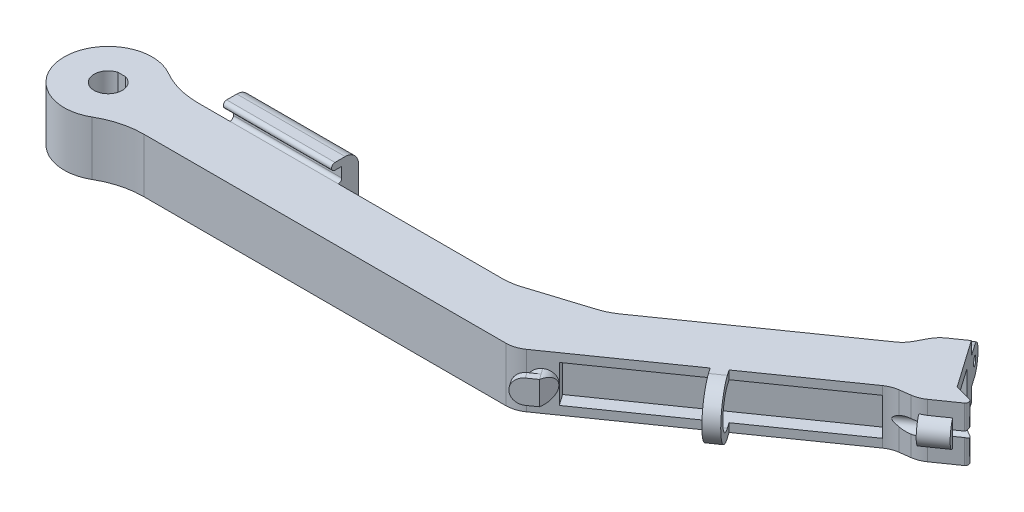
from build123d import *

# Parameters (mm, degrees)
BOSS_EXTRUDE1_DEPTH       = 12.7
SKETCH4_R                 = 10.31875
BOSS_EXTRUDE2_DEPTH       = 12.7
CUT_EXTRUDE1_DEPTH        = 64.271385342
BOSS_EXTRUDE3_DEPTH       = 12.7
BOSS_EXTRUDE4_DEPTH       = 12.7
CUT_EXTRUDE3_START        = -2.794
CUT_EXTRUDE3_DEPTH        = 6.858
BOSS_EXTRUDE5_DEPTH       = 5.715
BOSS_EXTRUDE10_START      = -12.7
BOSS_EXTRUDE10_DEPTH      = 12.7
SKETCH14_W                = 1.0287
SKETCH14_H                = 10.856543086
F_1_CLEARANCE_HOLE3_D     = 2.0574
SKETCH15_R                = 1.5875
CUT_EXTRUDE4_DEPTH        = 7.3025
FILLET1_R                 = 6.35
SKETCH19_W                = 0.8
SKETCH19_H                = 45.577066542
BOSS_EXTRUDE6_DEPTH       = 3.175
F_1_CLEARANCE_HOLE2_D     = 2.0574
F_1_CLEARANCE_HOLE2_DEPTH = 3.175
BOSS_EXTRUDE8_START       = -3.571875
BOSS_EXTRUDE8_DEPTH       = 5.55625
FILLET4_R                 = 2.778125
SKETCH27_W                = 54.393396404
SKETCH27_H                = 8.73125
CUT_EXTRUDE7_DEPTH        = 3.175
FILLET5_RADIUS            = 2.778125
FILLET5_LENGTH            = 1.5875
CUT_EXTRUDE8_DEPTH        = 129.352845118
BOSS_EXTRUDE9_START       = -38.1
BOSS_EXTRUDE9_DEPTH       = 3.175
FILLET6_R                 = 0.79375
BOSS_EXTRUDE11_DEPTH      = 12.7
FILLET7_R                 = 12.7
BOSS_EXTRUDE12_DEPTH      = 4.7625
BOSS_EXTRUDE12_DEPTH_BACK = 17.4625
SKETCH36_W                = 25.4
SKETCH36_H                = 6.35
SKETCH37_W                = 2.38125
SKETCH37_H                = 3.175
CUT_EXTRUDE9_DEPTH        = 25.4
FILLET8_R                 = 3.175
FILLET9_R                 = 0.79375
FILLET10_RADIUS           = 0.79375
FILLET10_LENGTH           = 25.4
FILLET11_RADIUS           = 0.79375
FILLET11_LENGTH           = 25.4
FILLET12_R                = 19.05


# Some blends are built 0.0001 mm under size
with BuildPart() as part:
    # Sketch1 → Boss-Extrude1 (new body)
    with BuildSketch(Plane(origin=(0, 0, 0), x_dir=(1, 0, 0), z_dir=(0, 1, 0))):
        with BuildLine():
            Line((-50.8, 6.35), (50.8, 6.35))
            Line((50.8, 6.35), (50.8, -6.35))
            Line((50.8, -6.35), (-50.8, -6.35))
            ThreePointArc((-50.8, -6.35), (-57.15, 0), (-50.8, 6.35))
        make_face()
    extrude(amount=BOSS_EXTRUDE1_DEPTH)

    # Sketch4 → Boss-Extrude2 (add)
    with BuildSketch(Plane.XZ):
        with Locations((-50.8, 0)):
            Circle(SKETCH4_R)
    extrude(amount=-BOSS_EXTRUDE2_DEPTH)

    # Sketch5 → Cut-Extrude1 (cut, through all)
    with BuildSketch(Plane(origin=(0, 12.7, 0), x_dir=(-1, 0, 0), z_dir=(0, 1, 0))):
        with BuildLine():
            Line((51.689, -3.180075942), (49.911, -3.180075942))
            ThreePointArc((49.911, -3.180075942), (50.8, 3.302), (51.689, -3.180075942))
        make_face()
    extrude(amount=-CUT_EXTRUDE1_DEPTH, mode=Mode.SUBTRACT)

    # Sketch6 → Boss-Extrude3 (add)
    with BuildSketch(Plane(origin=(0, 12.7, 0), x_dir=(1, 0, 0), z_dir=(0, 1, 0))):
        Polygon((95.531734071, 40.475334671), (102.816154812, 30.072103708), (50.8, -6.35), (46.795705381, 6.35), align=None)
    extrude(amount=-BOSS_EXTRUDE3_DEPTH)

    # Sketch9 → Boss-Extrude4 (add)
    with BuildSketch(Plane(origin=(0, 12.7, 0), x_dir=(1, 0, 0), z_dir=(0, 1, 0))):
        Polygon((102.848212808, 48.757142484), (98.135919581, 45.457559244), (95.531734071, 40.475334671), (102.816154812, 30.072103708), (108.38859838, 30.815216452), (113.100891608, 34.114799693), (110.735347669, 37.493146554), (105.213756747, 45.378795623), align=None)
    extrude(amount=-BOSS_EXTRUDE4_DEPTH)

    # Sketch11 → Cut-Extrude3 (cut)
    with BuildSketch(Plane(origin=(0, 12.7, 0), x_dir=(1, 0, 0), z_dir=(0, 1, 0)).offset(CUT_EXTRUDE3_START)):
        Polygon((97.154584621, 40.282155504), (103.189673352, 31.663155561), (108.028410915, 35.051276078), (110.596943675, 37.690807942), (105.352160741, 45.181134235), (101.993322184, 43.670276021), align=None)
    extrude(amount=-CUT_EXTRUDE3_DEPTH, mode=Mode.SUBTRACT)

    # Sketch12 → Boss-Extrude5 (add)
    with BuildSketch(Plane(origin=(91.920550149, 0, -64.36346213), x_dir=(-0.5735764363510415, 0, -0.819152044288995), z_dir=(0.819152044288995, 0, -0.5735764363510415))):
        with BuildLine():
            Line((-36.133048448, 9.525), (-36.133048448, 3.175))
            ThreePointArc((-36.133048448, 3.175), (-39.308048448, 6.35), (-36.133048448, 9.525))
        make_face()
    extrude(amount=-BOSS_EXTRUDE5_DEPTH)

    # Sketch32 → Boss-Extrude10 (add)
    with BuildSketch(Plane(origin=(0, 12.7, 0), x_dir=(1, 0, 0), z_dir=(0, 1, 0)).offset(BOSS_EXTRUDE10_START)):
        Polygon((113.100891608, 34.114799693), (110.596871978, 37.690910336), (116.10160473, 36.215921641), align=None)
    extrude(amount=BOSS_EXTRUDE10_DEPTH)

    # Sketch14 → #1 Clearance Hole1 (revolve, cut)
    with BuildSketch(Plane(origin=(112.645615312, 6.35, -34.765001628), x_dir=(0.5735764363510415, 0, 0.819152044288995), z_dir=(0, 1, 0))):
        with Locations((0.51435, 5.428271543)):
            Rectangle(SKETCH14_W, SKETCH14_H)
    revolve(axis=Axis((107.443999831, 6.35, -31.122791257), (0.819152044288995, 0, -0.5735764363510414)), mode=Mode.SUBTRACT)

    # #1 Clearance Hole3 (through all)
    with Locations(Plane(origin=(91.920550149, 0, -64.36346213), x_dir=(-0.5735764363510417, 0, -0.8191520442889949), z_dir=(0.819152044288995, 0, -0.5735764363510417))):
        with Locations((-36.133048448, 6.35)):
            Hole(F_1_CLEARANCE_HOLE3_D / 2)

    # Sketch15 → Cut-Extrude4 (cut)
    with BuildSketch(Plane(origin=(87.239096215, 0, -61.085472797), x_dir=(0.5735764363510416, 0, 0.819152044288995), z_dir=(-0.8191520442889949, 0, 0.5735764363510415))):
        with Locations((36.133048448, 6.35)):
            Circle(SKETCH15_R)
    extrude(amount=CUT_EXTRUDE4_DEPTH, mode=Mode.SUBTRACT)

    # Fillet1
    # the kernel refuses this fillet: 6.35 mm, written as the material it adds along each edge
    with BuildSketch(Plane(origin=(102.816154812, 12.7, -30.072103708), x_dir=(0.9912250978402455, 0, -0.13218473970771358), z_dir=(0, -1, 0))) as fillet1_piece_1_section:
        with BuildLine():
            CenterArc((FILLET1_R * 0.243812013736, FILLET1_R), FILLET1_R, 242.595858364, 27.404141636)
            Line((-FILLET1_R * 0.21645194575, FILLET1_R * 0.112217882812), (0, 0))
            Line((0, 0), (FILLET1_R * 0.243812013736, 0))
        make_face()
    fillet1_piece_1 = extrude(amount=12.7, mode=Mode.PRIVATE)
    fillet1_piece_1 = fillet1_piece_1 - Plane(origin=(103.804018462, 6.35, -28.574048864), x_dir=(0.5735764363510416, 0, 0.819152044288995), z_dir=(0.819152044288995, 0, -0.5735764363510416)) * Cylinder(1.5875, 32, mode=Mode.PRIVATE)
    add(fillet1_piece_1)
    with BuildSketch(Plane(origin=(95.531734071, 12.7, -40.475334671), x_dir=(-0.8191520442889939, 0, 0.573576436351043), z_dir=(0, -1, 0))) as fillet1_piece_2:
        with BuildLine():
            CenterArc((FILLET1_R * 0.243812013736, FILLET1_R), FILLET1_R, 242.595858364, 27.404141636)
            Line((-FILLET1_R * 0.21645194575, FILLET1_R * 0.112217882812), (0, 0))
            Line((0, 0), (FILLET1_R * 0.243812013736, 0))
        make_face()
    extrude(amount=12.7)
    # the kernel refuses this fillet: 6.35 mm, written as the material it takes off along each edge
    with BuildSketch(Plane(origin=(108.38859838, 16.570515718, -30.815216452), x_dir=(-0.9912250978402455, 0, 0.13218473970771358), z_dir=(0, -1, 0))) as fillet1_2_piece_1_section:
        with BuildLine():
            CenterArc((FILLET1_R * 0.243812013736, FILLET1_R), FILLET1_R, 242.595858364, 27.404141636)
            Line((-FILLET1_R * 0.21645194575, FILLET1_R * 0.112217882812), (0, 0))
            Line((0, 0), (FILLET1_R * 0.243812013736, 0))
        make_face()
    fillet1_2_piece_1 = extrude(amount=12.716216108, mode=Mode.PRIVATE)
    fillet1_2_piece_1 = split(fillet1_2_piece_1, bisect_by=Plane(origin=(108.289049295, 11.085798471, -31.023024265), z_dir=(-0.819152044288995, 0, 0.5735764363510415)), keep=Keep.TOP, mode=Mode.PRIVATE)
    add(fillet1_2_piece_1, mode=Mode.SUBTRACT)
    with BuildSketch(Plane(origin=(108.38859838, 16.570515718, -30.815216452), x_dir=(-0.9912250978402455, 0, 0.13218473970771358), z_dir=(0, -1, 0))) as fillet1_2_piece_2_section:
        with BuildLine():
            CenterArc((FILLET1_R * 0.243812013736, FILLET1_R), FILLET1_R, 242.595858364, 27.404141636)
            Line((-FILLET1_R * 0.21645194575, FILLET1_R * 0.112217882812), (0, 0))
            Line((0, 0), (FILLET1_R * 0.243812013736, 0))
        make_face()
    fillet1_2_piece_2 = extrude(amount=12.716216108, mode=Mode.PRIVATE)
    fillet1_2_piece_2 = fillet1_2_piece_2 - Plane(origin=(108.273018004, 6.35, -31.703276031), x_dir=(0, -1, 0), z_dir=(0.819152044288995, 0, -0.5735764363510415)) * Cylinder(3.175, 32, mode=Mode.PRIVATE)
    add(fillet1_2_piece_2, mode=Mode.SUBTRACT)
    with BuildSketch(Plane(origin=(108.38859838, 8.84570039, -30.815216452), x_dir=(-0.9912250978402455, 0, 0.13218473970771358), z_dir=(0, -1, 0))) as fillet1_2_piece_3_section:
        with BuildLine():
            CenterArc((FILLET1_R * 0.243812013736, FILLET1_R), FILLET1_R, 242.595858364, 27.404141636)
            Line((-FILLET1_R * 0.21645194575, FILLET1_R * 0.112217882812), (0, 0))
            Line((0, 0), (FILLET1_R * 0.243812013736, 0))
        make_face()
    fillet1_2_piece_3 = extrude(amount=12.716216108, mode=Mode.PRIVATE)
    fillet1_2_piece_3 = split(fillet1_2_piece_3, bisect_by=Plane(origin=(108.291596218, 8.335689019, -31.019386881), z_dir=(-0.819152044288995, 0, 0.5735764363510415)), keep=Keep.TOP, mode=Mode.PRIVATE)
    add(fillet1_2_piece_3, mode=Mode.SUBTRACT)
    with BuildSketch(Plane(origin=(108.38859838, 8.84570039, -30.815216452), x_dir=(-0.9912250978402455, 0, 0.13218473970771358), z_dir=(0, -1, 0))) as fillet1_2_piece_4_section:
        with BuildLine():
            CenterArc((FILLET1_R * 0.243812013736, FILLET1_R), FILLET1_R, 242.595858364, 27.404141636)
            Line((-FILLET1_R * 0.21645194575, FILLET1_R * 0.112217882812), (0, 0))
            Line((0, 0), (FILLET1_R * 0.243812013736, 0))
        make_face()
    fillet1_2_piece_4 = extrude(amount=12.716216108, mode=Mode.PRIVATE)
    fillet1_2_piece_4 = fillet1_2_piece_4 - Plane(origin=(108.273018003, 6.35, -31.703276031), x_dir=(0, -1, 0), z_dir=(0.819152044288995, 0, -0.5735764363510415)) * Cylinder(3.175, 32, mode=Mode.PRIVATE)
    add(fillet1_2_piece_4, mode=Mode.SUBTRACT)
    with BuildSketch(Plane(origin=(98.135919581, 16.570515718, -45.457559244), x_dir=(0.8191520442889939, 0, -0.573576436351043), z_dir=(0, -1, 0))) as fillet1_2_piece_5:
        with BuildLine():
            CenterArc((FILLET1_R * 0.243812013736, FILLET1_R), FILLET1_R, 242.595858364, 27.404141636)
            Line((-FILLET1_R * 0.21645194575, FILLET1_R * 0.112217882812), (0, 0))
            Line((0, 0), (FILLET1_R * 0.243812013736, 0))
        make_face()
    extrude(amount=20.441031436, mode=Mode.SUBTRACT)
    with BuildSketch(Plane(origin=(50.8, -5.005368273, 6.35), x_dir=(0.8191520442889954, 0, -0.5735764363510407), z_dir=(0, 1, 0))) as fillet1_2_piece_6:
        with BuildLine():
            CenterArc((FILLET1_R * 0.315298788879, FILLET1_R), FILLET1_R, 235, 35)
            Line((-FILLET1_R * 0.258277647472, FILLET1_R * 0.180847955711), (0, 0))
            Line((0, 0), (FILLET1_R * 0.315298788879, 0))
        make_face()
    extrude(amount=22.710736547, mode=Mode.SUBTRACT)

    # Sketch19 → M2x0.4 Tapped Hole2 (revolve, cut)
    with BuildSketch(Plane(origin=(-50.8, 6.35, -3.180075942), x_dir=(0, -1, 0), z_dir=(1, 0, 0))):
        with Locations((0.4, 22.788533271)):
            Rectangle(SKETCH19_W, SKETCH19_H)
    revolve(axis=Axis((-50.8, 6.35, 3.169924058), (0, 0, -1)), mode=Mode.SUBTRACT)

    # Sketch20 → Boss-Extrude6 (add)
    with BuildSketch(Plane(origin=(91.920550149, 0, -64.36346213), x_dir=(-0.5735764363510416, 0, -0.819152044288995), z_dir=(0.8191520442889949, 0, -0.5735764363510415))):
        with BuildLine():
            Line((-19.051798448, 9.525), (-15.876798448, 9.525))
            ThreePointArc((-15.876798448, 9.525), (-12.701798448, 6.35), (-15.876798448, 3.175))
            Line((-15.876798448, 3.175), (-19.051798448, 3.175))
            Line((-19.051798448, 3.175), (-19.051798448, 9.525))
        make_face()
    extrude(amount=-BOSS_EXTRUDE6_DEPTH)

    # #1 Clearance Hole2
    with Locations(Plane(origin=(91.920550149, 0, -64.36346213), x_dir=(-0.5735764363510416, 0, -0.819152044288995), z_dir=(0.8191520442889949, 0, -0.5735764363510415))):
        with Locations((-15.876798448, 6.35)):
            Hole(F_1_CLEARANCE_HOLE2_D / 2, depth=F_1_CLEARANCE_HOLE2_DEPTH)

    # Sketch26 → Boss-Extrude8 (add)
    with BuildSketch(Plane(origin=(0, 12.7, 0), x_dir=(1, 0, 0), z_dir=(0, 1, 0)).offset(BOSS_EXTRUDE8_START)):
        Polygon((52.440063061, -5.201615481), (53.350615654, -6.502019352), (51.400009849, -7.867848241), (52.310562441, -9.168252111), (58.812581793, -4.615489147), (56.991476608, -2.014681407), align=None)
    extrude(amount=-BOSS_EXTRUDE8_DEPTH)

    # Fillet4
    fillet4_edges = [part.edges().sort_by_distance(p)[0] for p in [
        (57.9020292, 3.571875, 3.315085277),
        (52.895339358, 3.571875, 5.851817416),
        (57.9020292, 9.128125, 3.315085277),
        (52.895339358, 9.128125, 5.851817416),
    ]]
    fillet(fillet4_edges, radius=FILLET4_R - 0.0001)  # a hair under: the kernel refuses the full size

    # Sketch27 → Cut-Extrude7 (cut)
    with BuildSketch(Plane(origin=(19.696212431, 0, 28.129106523), x_dir=(0.8191520442889949, 0, -0.5735764363510418), z_dir=(0.5735764363510418, 0, 0.8191520442889949))):
        with Locations((72.72580899, 6.35)):
            Rectangle(SKETCH27_W, SKETCH27_H)
    extrude(amount=-CUT_EXTRUDE7_DEPTH, mode=Mode.SUBTRACT)

    # Fillet5: full round fillet: the end face becomes a half cylinder, R = half its width
    fillet5_face = Plane((51.855286145, 6.35, 8.518050176), x_dir=(0.573576436351, 0, 0.819152044289), z_dir=(-0.819152044289, 0, 0.573576436351))  # on the end face: x along it, z out of the body
    fillet5_slab = fillet5_face.offset(-FILLET5_RADIUS / 2) * Box(FILLET5_LENGTH, 2 * FILLET5_RADIUS, FILLET5_RADIUS, mode=Mode.PRIVATE)  # the body's end, R deep
    fillet5_round = Plane((54.130992918, 6.35, 6.924583139), x_dir=(-0.819152044289, 0, 0.573576436351), z_dir=(0.573576436351, 0, 0.819152044289)) * Cylinder(FILLET5_RADIUS, FILLET5_LENGTH, mode=Mode.PRIVATE)  # its axis R under the face
    add(fillet5_slab - fillet5_round, mode=Mode.SUBTRACT)

    # Sketch28 → Cut-Extrude8 (cut, through all)
    with BuildSketch(Plane(origin=(0, 9.128125, 0), x_dir=(1, 0, 0), z_dir=(0, 1, 0))):
        Polygon((56.53687502, -6.208956185), (57.219114756, -2.339782374), (58.812581793, -4.615489147), align=None)
    extrude(amount=-CUT_EXTRUDE8_DEPTH, mode=Mode.SUBTRACT)

    # Sketch30 → Boss-Extrude9 (add)
    with BuildSketch(Plane(origin=(91.920550149, 0, -64.36346213), x_dir=(-0.5735764363510417, 0, -0.8191520442889949), z_dir=(0.819152044288995, 0, -0.5735764363510417)).offset(BOSS_EXTRUDE9_START)):
        with BuildLine():
            Line((-34.339298448, 1.984375), (-34.339298448, 0))
            Line((-34.339298448, 0), (-35.926798448, 0))
            ThreePointArc((-35.926798448, 0), (-42.276798448, 6.35), (-35.926798448, 12.7))
            Line((-35.926798448, 12.7), (-34.339298448, 12.7))
            Line((-34.339298448, 12.7), (-34.339298448, 10.715625))
            Line((-34.339298448, 10.715625), (-35.926798448, 10.715625))
            ThreePointArc((-35.926798448, 10.715625), (-40.292423448, 6.35), (-35.926798448, 1.984375))
            Line((-35.926798448, 1.984375), (-34.339298448, 1.984375))
        make_face()
    extrude(amount=-BOSS_EXTRUDE9_DEPTH)

    # Fillet6
    fillet6_edges = [part.edges().sort_by_distance(p)[0] for p in [
        (116.10160473, 2.84782091, -36.215921641),
        (116.10160473, 9.85217909, -36.215921641),
    ]]
    fillet(fillet6_edges, radius=FILLET6_R)

    # Sketch35 → Boss-Extrude11 (add)
    with BuildSketch(Plane.XZ):
        Polygon((54.598128603, -11.813315556), (37.270705381, -6.35), (46.795705381, -6.35), align=None)
    extrude(amount=-BOSS_EXTRUDE11_DEPTH)

    # Fillet7
    fillet7_edges = [part.edges().sort_by_distance(p)[0] for p in [
        (37.270705381, 6.35, -6.35),
        (54.598128603, 6.35, -11.813315556),
    ]]
    fillet(fillet7_edges, radius=FILLET7_R)

    # Sketch36 → Boss-Extrude12 (add, two sides: drawn at the far end of the back side and taken through both)
    with BuildSketch(Plane(origin=(0, 12.7, 0), x_dir=(1, 0, 0), z_dir=(0, 1, 0)).offset(-BOSS_EXTRUDE12_DEPTH_BACK)):
        with Locations((-15.875, 7.9375)):
            Rectangle(SKETCH36_W, SKETCH36_H)
    extrude(amount=BOSS_EXTRUDE12_DEPTH + BOSS_EXTRUDE12_DEPTH_BACK)

    # Sketch37 → Cut-Extrude9 (cut)
    with BuildSketch(Plane.ZY.offset(28.575)):
        with Locations((-5.953125, 14.2875)):
            Rectangle(SKETCH37_W, SKETCH37_H)
        with Locations((-5.953125, -1.5875)):
            Rectangle(SKETCH37_W, SKETCH37_H)
    extrude(amount=-CUT_EXTRUDE9_DEPTH, mode=Mode.SUBTRACT)

    # Fillet8
    fillet8_edges = [part.edges().sort_by_distance(p)[0] for p in [
        (-15.875, -4.7625, -11.1125),
        (-15.875, 17.4625, -11.1125),
    ]]
    fillet(fillet8_edges, radius=FILLET8_R)

    # Fillet9
    fillet9_edges = [part.edges().sort_by_distance(p)[0] for p in [
        (-15.875, 0, -7.14375),
        (-15.875, 12.7, -7.14375),
    ]]
    fillet(fillet9_edges, radius=FILLET9_R)

    # Fillet10: full round fillet: the end face becomes a half cylinder, R = half its width
    fillet10_face = Plane((-15.875, 16.66875, -4.7625), x_dir=(-1, 0, 0), z_dir=(0, 0, 1))  # on the end face: x along it, z out of the body
    fillet10_slab = fillet10_face.offset(-FILLET10_RADIUS / 2) * Box(FILLET10_LENGTH, 2 * FILLET10_RADIUS, FILLET10_RADIUS, mode=Mode.PRIVATE)  # the body's end, R deep
    fillet10_round = Plane((-15.875, 16.66875, -5.55625), x_dir=(0, 0, 1), z_dir=(-1, 0, 0)) * Cylinder(FILLET10_RADIUS, FILLET10_LENGTH, mode=Mode.PRIVATE)  # its axis R under the face
    add(fillet10_slab - fillet10_round, mode=Mode.SUBTRACT)

    # Fillet11: full round fillet: the end face becomes a half cylinder, R = half its width
    fillet11_face = Plane((-15.875, -3.96875, -4.7625), x_dir=(1, 0, 0), z_dir=(0, 0, 1))  # on the end face: x along it, z out of the body
    fillet11_slab = fillet11_face.offset(-FILLET11_RADIUS / 2) * Box(FILLET11_LENGTH, 2 * FILLET11_RADIUS, FILLET11_RADIUS, mode=Mode.PRIVATE)  # the body's end, R deep
    fillet11_round = Plane((-15.875, -3.96875, -5.55625), x_dir=(0, 0, 1), z_dir=(1, 0, 0)) * Cylinder(FILLET11_RADIUS, FILLET11_LENGTH, mode=Mode.PRIVATE)  # its axis R under the face
    add(fillet11_slab - fillet11_round, mode=Mode.SUBTRACT)

    # Fillet12
    fillet12_edges = [part.edges().sort_by_distance(p)[0] for p in [
        (-42.66648283, 6.35, -6.35),
        (-42.66648283, 6.35, 6.35),
    ]]
    fillet(fillet12_edges, radius=FILLET12_R)


solid = part.part
